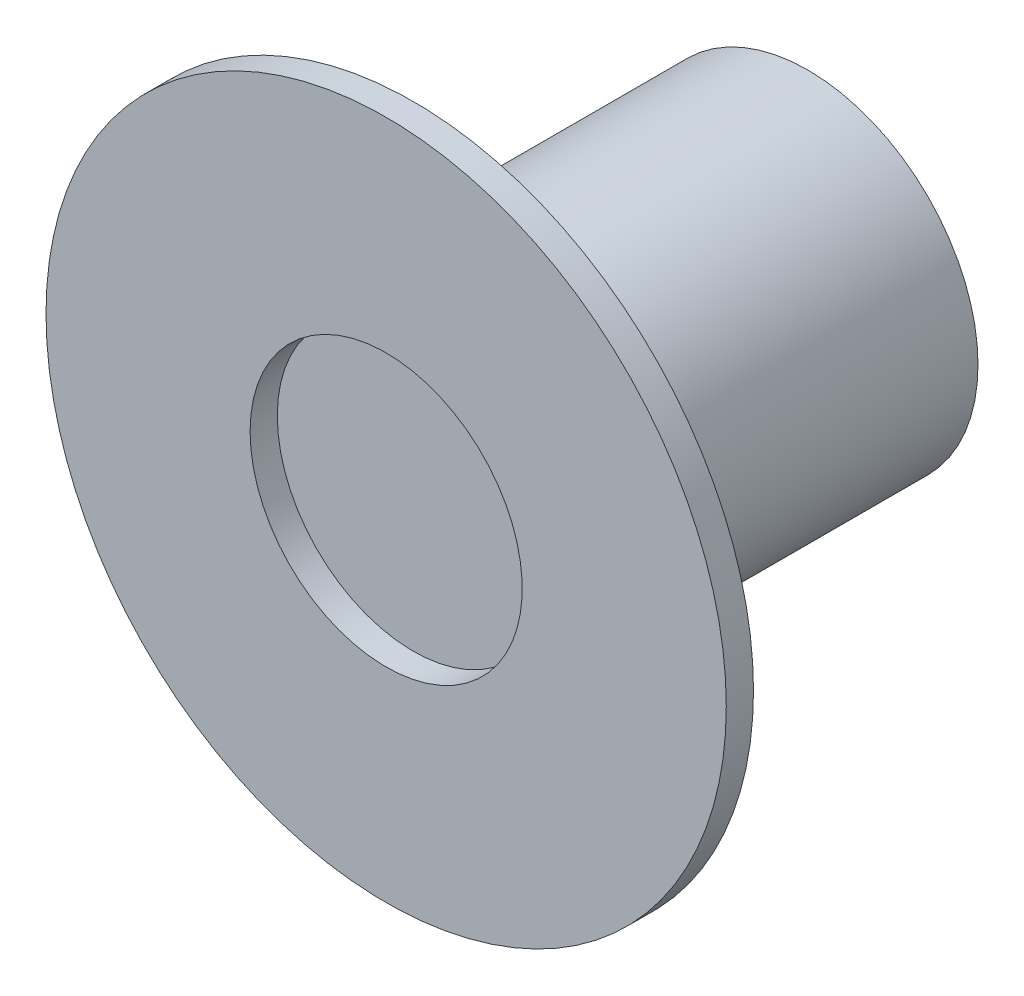
from build123d import *

# Parameters (mm, degrees)
SKETCH_2_R          = 25
SKETCH_2_R_2        = 10
EXTRUDE_2_DEPTH     = 2
SKETCH_35_R         = 13.5
EXTRUDE_3_DEPTH     = 2
SKETCH_36_R         = 12.5
EXTRUDE_4_DEPTH     = 27
CUT_EXTRUDE_START   = -3
SKETCH_37_R         = 10
CUT_EXTRUDE_3_DEPTH = 3


with BuildPart() as part:
    # 스케치2 → 보스-돌출2 (new body)
    with BuildSketch(Plane(origin=(0, 6, 0), x_dir=(1, 0, 0), z_dir=(0, 0, -1))):
        with Locations((0, 6)):
            Circle(SKETCH_2_R)
        with Locations((0, 6)):
            Circle(SKETCH_2_R_2, mode=Mode.SUBTRACT)
    extrude(amount=EXTRUDE_2_DEPTH)

    # 스케치35 → 보스-돌출3 (add)
    with BuildSketch(Plane(origin=(0, 0, -2), x_dir=(-1, 0, 0), z_dir=(0, 0, -1))):
        Circle(SKETCH_35_R)
    extrude(amount=EXTRUDE_3_DEPTH)

    # 스케치36 → 보스-돌출4 (add)
    with BuildSketch(Plane(origin=(0, 0, -4), x_dir=(-1, 0, 0), z_dir=(0, 0, -1))):
        Circle(SKETCH_36_R)
    extrude(amount=EXTRUDE_4_DEPTH)

    # 스케치37 → 컷-돌출3 (cut)
    with BuildSketch(Plane(origin=(0, 0, -31), x_dir=(-1, 0, 0), z_dir=(0, 0, -1)).offset(CUT_EXTRUDE_START)):
        Circle(SKETCH_37_R)
    extrude(amount=CUT_EXTRUDE_3_DEPTH, mode=Mode.SUBTRACT)


solid = part.part
